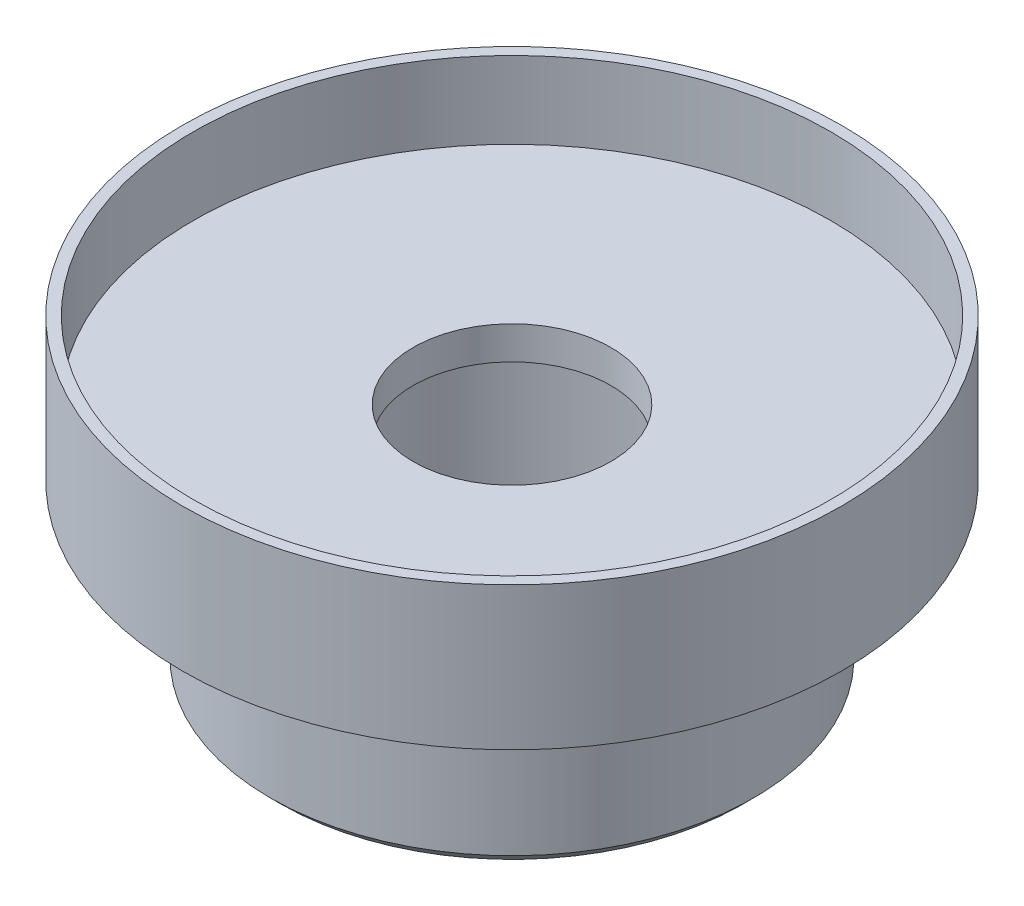
from build123d import *

# Parameters (mm, degrees)
ESQUISSE1_R             = 11
BOSS_EXTRU_1_DEPTH      = 7.5
ESQUISSE3_R             = 15
BOSS_EXTRU_2_DEPTH      = 6.5
CHANFREIN1_SIZE         = 0.5
CHANFREIN2_SIZE         = 1
ESQUISSE4_R             = 14.5
ENL_V_MAT_EXTRU_1_DEPTH = 3.5
ESQUISSE5_R             = 4.5
ENL_V_MAT_EXTRU_2_DEPTH = 1.5
ESQUISSE6_R             = 7
ENL_V_MAT_EXTRU_3_DEPTH = 1
ESQUISSE20_R            = 8
ENL_V_MAT_EXTRU_4_DEPTH = 8


with BuildPart() as part:
    # Esquisse1 → Boss.-Extru.1 (new body)
    with BuildSketch(Plane(origin=(0, 0, 0), x_dir=(1, 0, 0), z_dir=(0, 1, 0))):
        Circle(ESQUISSE1_R)
    extrude(amount=BOSS_EXTRU_1_DEPTH)

    # Esquisse3 → Boss.-Extru.2 (add)
    with BuildSketch(Plane(origin=(0, 7.5, 0), x_dir=(1, 0, 0), z_dir=(0, 1, 0))):
        Circle(ESQUISSE3_R)
    extrude(amount=BOSS_EXTRU_2_DEPTH)

    # Chanfrein1
    chanfrein1_edges = [part.edges().sort_by_distance(p)[0] for p in [
        (-11, 0, 0),
    ]]
    chamfer(chanfrein1_edges, length=CHANFREIN1_SIZE)

    # Chanfrein2
    chanfrein2_edges = [part.edges().sort_by_distance(p)[0] for p in [
        (-11, 7.5, 0),
    ]]
    chamfer(chanfrein2_edges, length=CHANFREIN2_SIZE)

    # Esquisse4 → Enlèv. mat.-Extru.1 (cut)
    with BuildSketch(Plane(origin=(0, 14, 0), x_dir=(1, 0, 0), z_dir=(0, 1, 0))):
        Circle(ESQUISSE4_R)
    extrude(amount=-ENL_V_MAT_EXTRU_1_DEPTH, mode=Mode.SUBTRACT)

    # Esquisse5 → Enlèv. mat.-Extru.2 (cut)
    with BuildSketch(Plane(origin=(0, 10.5, 0), x_dir=(1, 0, 0), z_dir=(0, 1, 0))):
        Circle(ESQUISSE5_R)
    extrude(amount=-ENL_V_MAT_EXTRU_2_DEPTH, mode=Mode.SUBTRACT)

    # Esquisse6 → Enlèv. mat.-Extru.3 (cut)
    with BuildSketch(Plane(origin=(0, 9, 0), x_dir=(1, 0, 0), z_dir=(0, 1, 0))):
        Circle(ESQUISSE6_R)
    extrude(amount=-ENL_V_MAT_EXTRU_3_DEPTH, mode=Mode.SUBTRACT)

    # Esquisse20 → Enlèv. mat.-Extru.4 (cut)
    with BuildSketch(Plane(origin=(0, 8, 0), x_dir=(1, 0, 0), z_dir=(0, 1, 0))):
        Circle(ESQUISSE20_R)
    extrude(amount=-ENL_V_MAT_EXTRU_4_DEPTH, mode=Mode.SUBTRACT)


solid = part.part
